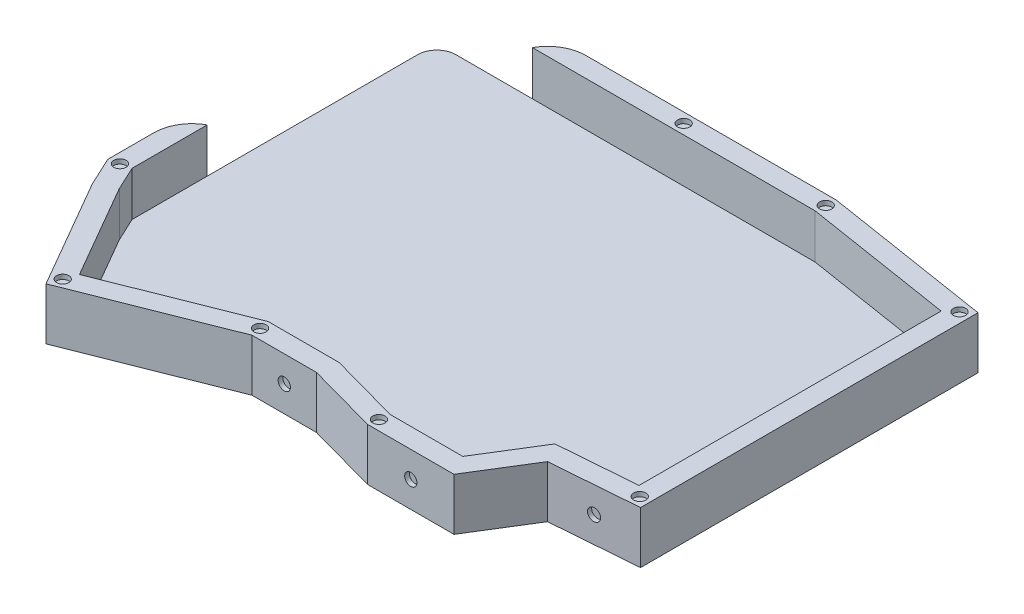
from build123d import *

# Parameters (mm, degrees)
BOSS_EXTRUDE1_DEPTH = 2
BOSS_EXTRUDE2_DEPTH = 13.6
CUT_EXTRUDE1_DEPTH  = 204.774312539
TOP_HOLES_D         = 3.2
TOP_HOLES_DEPTH     = 1.2
WRIST_1_D           = 3.2
WRIST_1_DEPTH       = 1.2
WRIST_2_D           = 3.2
WRIST_2_DEPTH       = 1.2
WRIST_3_D           = 3.2
WRIST_3_DEPTH       = 1.2
FILLET1_R           = 5
FILLET2_R           = 10
FILLET3_R           = 10


with BuildPart() as part:
    # outline → Boss-Extrude1 (new body)
    with BuildSketch(Plane(origin=(0, 0, 0), x_dir=(1, 0, 0), z_dir=(0, 1, 0))):
        Polygon((22.752080985, 112.217917805), (22.752080985, 32.585832501), (25.688129691, 26.292829341), (39.910245267, 1.671913524), (75.213887712, 15.680109343), (93.764616437, 15.680109343), (112.21601573, 10.581860359), (131.186066133, 10.581860359), (140.397681326, 25.454275085), (160.788080985, 27.045655036), (160.788080985, 105.9953847), (121.597788595, 112.217917805), align=None)
    extrude(amount=BOSS_EXTRUDE1_DEPTH)

    # outline<7> → Boss-Extrude2 (add)
    with BuildSketch(Plane(origin=(0, 0, 0), x_dir=(1, 0, 0), z_dir=(0, 1, 0))):
        Polygon((165.988080985, 110.434880876), (122.008040315, 117.417917805), (17.552080985, 117.417917805), (17.552080985, 31.432460189), (21.071788866, 23.888466533), (37.653795388, -4.817824349), (76.207852469, 10.480109343), (93.059430407, 10.480109343), (111.510829699, 5.381860359), (134.081949487, 5.381860359), (143.430369308, 20.475150048), (165.988080985, 22.235679058), align=None)
        Polygon((121.597788595, 112.217917805), (22.752080985, 112.217917805), (22.752080985, 32.585832501), (25.688129691, 26.292829341), (39.910245267, 1.671913524), (75.213887712, 15.680109343), (93.764616437, 15.680109343), (112.21601573, 10.581860359), (131.186066133, 10.581860359), (140.397681326, 25.454275085), (160.788080985, 27.045655036), (160.788080985, 105.9953847), align=None, mode=Mode.SUBTRACT)
    extrude(amount=BOSS_EXTRUDE2_DEPTH)

    # cutout → Cut-Extrude1 (cut, through all)
    with BuildSketch(Plane(origin=(0, 0, 0), x_dir=(1, 0, 0), z_dir=(0, 1, 0))):
        Polygon((17.552080985, 117.417917805), (17.552080985, 52.217917805), (22.752080985, 52.217917805), (22.752080985, 112.217917805), (47.752080985, 112.217917805), (47.752080985, 117.417917805), align=None)
    extrude(amount=CUT_EXTRUDE1_DEPTH, mode=Mode.SUBTRACT)

    # top holes
    with Locations(Plane(origin=(0, 13.6, 0), x_dir=(1, 0, 0), z_dir=(0, 1, 0))):
        with Locations((84.67493479, 114.817917805), (20.152080985, 32.009146345), (38.782020327, -1.572955412), (75.710870091, 13.080109343), (111.863422715, 7.981860359), (163.388080985, 24.640667047), (163.388080985, 108.215132788), (121.802914455, 114.817917805)):
            Hole(TOP_HOLES_D / 2, depth=TOP_HOLES_DEPTH)

    # wrist 1
    with Locations(Plane.XY.offset(-10.480109343)):
        with Locations((84.633641438, 6.8)):
            Hole(WRIST_1_D / 2, depth=WRIST_1_DEPTH)

    # wrist 2
    with Locations(Plane.XY.offset(-5.381860359)):
        with Locations((122.796389593, 6.8)):
            Hole(WRIST_2_D / 2, depth=WRIST_2_DEPTH)

    # wrist 3
    with Locations(Plane(origin=(-0.719959147, 0, -9.224858415), x_dir=(0.9969682889311796, 0, -0.07780893821172487), z_dir=(0.07780893821172487, 0, 0.9969682889311796))):
        with Locations((155.901833608, 6.8)):
            Hole(WRIST_3_D / 2, depth=WRIST_3_DEPTH)

    # Fillet1
    fillet1_edges = [part.edges().sort_by_distance(p)[0] for p in [
        (22.752080985, 1, -112.217917805),
    ]]
    fillet(fillet1_edges, radius=FILLET1_R)

    # Fillet2
    # the kernel refuses this fillet: 10 mm, written as the material it takes off along each edge
    with BuildSketch(Plane(origin=(47.752080985, -21.931712199, -117.417917805), x_dir=(0, 0, 1), z_dir=(0, 1, 0))) as fillet2_piece_1:
        with BuildLine():
            CenterArc((10, 8.77268488), FILLET2_R, 180, 61.314597986)
            Line((0, 8.77268488), (-0.2, 8.77268488))
            Line((-0.2, 8.77268488), (-0.2, 0))
            Line((-0.2, 0), (0, -0.2))
            ThreePointArc((0, -0.2), (2.6, -0.2), (5.104, -0.175453698))
            Line((5.104, -0.175453698), (5.2, 0))
        make_face()
    extrude(amount=57.463424399, mode=Mode.SUBTRACT)

    # Fillet3
    # the kernel refuses this fillet: 10 mm, written as the material it takes off along each edge
    with BuildSketch(Plane(origin=(17.552080985, -21.931712199, -52.217917805), x_dir=(0, 0, 1), z_dir=(0, 1, 0))) as fillet3_piece_1:
        with BuildLine():
            CenterArc((8.77268488, 10), FILLET3_R, 208.685402014, 61.314597986)
            Line((0, 5.2), (-0.175453698, 5.104))
            ThreePointArc((-0.175453698, 5.104), (-0.2, 2.6), (-0.2, 0))
            Line((-0.2, 0), (0, -0.2))
            Line((0, -0.2), (8.77268488, -0.2))
            Line((8.77268488, -0.2), (8.77268488, 0))
        make_face()
    extrude(amount=57.463424399, mode=Mode.SUBTRACT)


solid = part.part
